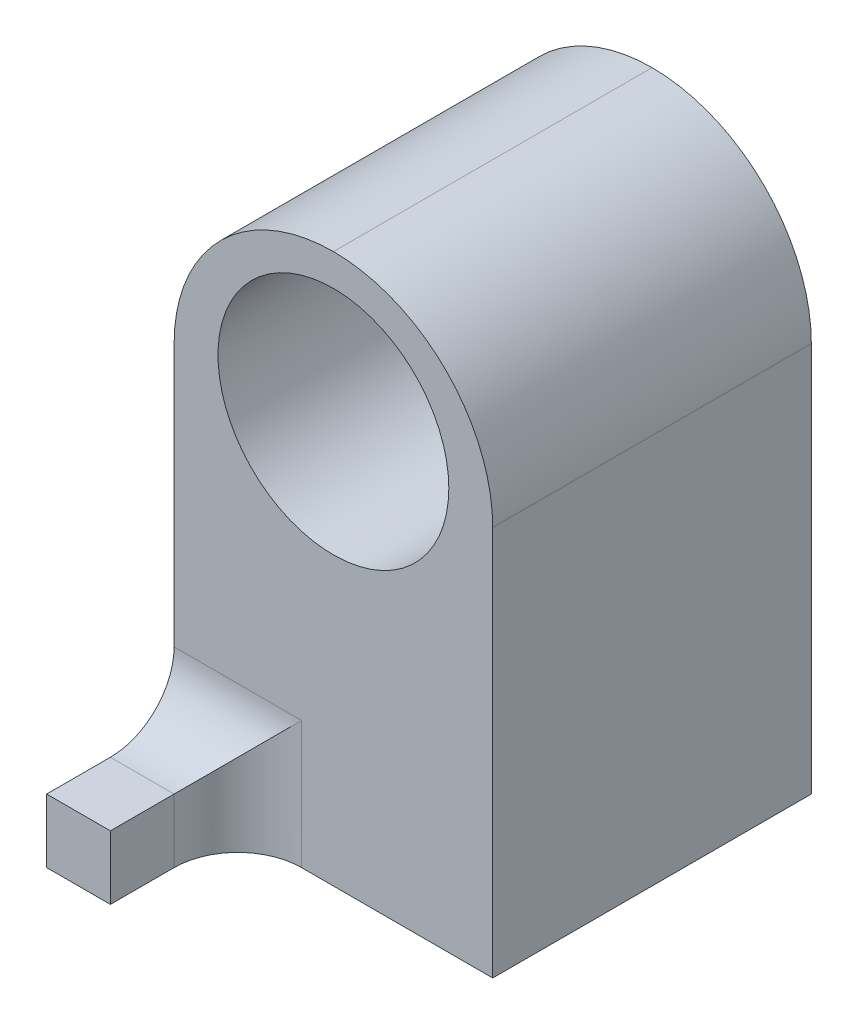
from build123d import *

# Parameters (mm, degrees)
SKETCH1_W           = 63.5
SKETCH1_H           = 63.5
SKETCH1_W_2         = 50.8
SKETCH1_H_2         = 50.8
BOSS_EXTRUDE1_DEPTH = 50.8
SKETCH2_W           = 63.5
SKETCH2_H           = 63.5
BOSS_EXTRUDE3_DEPTH = 6.35
SKETCH3_W           = 63.5
SKETCH3_H           = 63.5
BOSS_EXTRUDE4_DEPTH = 52.3494
SKETCH4_R           = 22.9997
CUT_EXTRUDE1_DEPTH  = 139.883012281
FILLET2_R           = 31.75
SKETCH5_W           = 12.7
SKETCH5_H           = 12.7
BOSS_EXTRUDE5_DEPTH = 25.4
FILLET3_R           = 12.7


with BuildPart() as part:
    # Sketch1 → Boss-Extrude1 (new body)
    with BuildSketch(Plane(origin=(0, 0, 0), x_dir=(1, 0, 0), z_dir=(0, 1, 0))):
        with Locations((25.4, 25.4)):
            Rectangle(SKETCH1_W, SKETCH1_H)
        with Locations((25.4, 25.4)):
            Rectangle(SKETCH1_W_2, SKETCH1_H_2, mode=Mode.SUBTRACT)
    extrude(amount=BOSS_EXTRUDE1_DEPTH)

    # Sketch2 → Boss-Extrude3 (add)
    with BuildSketch(Plane(origin=(0, 50.8, 0), x_dir=(1, 0, 0), z_dir=(0, 1, 0))):
        with Locations((25.4, 25.4)):
            Rectangle(SKETCH2_W, SKETCH2_H)
    extrude(amount=BOSS_EXTRUDE3_DEPTH)

    # Sketch3 → Boss-Extrude4 (add)
    with BuildSketch(Plane(origin=(0, 57.15, 0), x_dir=(1, 0, 0), z_dir=(0, 1, 0))):
        with Locations((25.4, 25.4)):
            Rectangle(SKETCH3_W, SKETCH3_H)
    extrude(amount=BOSS_EXTRUDE4_DEPTH)

    # Sketch4 → Cut-Extrude1 (cut, through all)
    with BuildSketch(Plane.XY.offset(6.35)):
        with Locations((25.4, 80.1497)):
            Circle(SKETCH4_R)
    extrude(amount=-CUT_EXTRUDE1_DEPTH, mode=Mode.SUBTRACT)

    # Fillet2
    fillet2_edges = [part.edges().sort_by_distance(p)[0] for p in [
        (-6.35, 109.4994, -25.4),
        (57.15, 109.4994, -25.4),
    ]]
    fillet(fillet2_edges, radius=FILLET2_R - 0.0001)  # a hair under: the kernel refuses the full size

    # Sketch5 → Boss-Extrude5 (add)
    with BuildSketch(Plane.XY.offset(6.35)):
        with Locations((0, 6.35)):
            Rectangle(SKETCH5_W, SKETCH5_H)
    extrude(amount=BOSS_EXTRUDE5_DEPTH)

    # Fillet3
    fillet3_edges = [part.edges().sort_by_distance(p)[0] for p in [
        (6.35, 6.35, 6.35),
        (0, 12.7, 6.35),
    ]]
    fillet(fillet3_edges, radius=FILLET3_R)


solid = part.part
